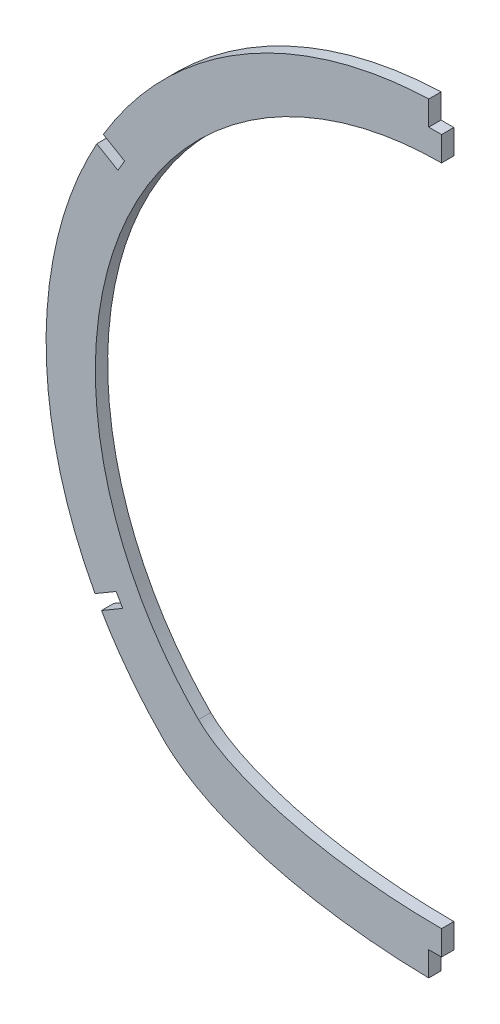
from build123d import *

# Parameters (mm, degrees)
BOSS_EXTRUDE1_DEPTH = 3.175
SKETCH3_W           = 129.389558459
SKETCH3_H           = 294.720660933
CUT_EXTRUDE1_DEPTH  = 146.946732918
SKETCH4_W           = 3.302
SKETCH4_H           = 12.7
CUT_EXTRUDE2_DEPTH  = 146.946732911


with BuildPart() as part:
    # Sketch2 → Boss-Extrude1 (new body)
    with BuildSketch(Plane.XY):
        with BuildLine():
            add(Edge.make_bspline(
                [(-71.677392112, -72.91043434), (-72.109242456, -72.4766599), (-72.972872043, -71.593614958), (-74.469591152, -70.002616718), (-75.837182996, -68.488043391), (-77.186084408, -66.931897067), (-78.515677479, -65.334729876), (-79.824432739, -63.69624614), (-81.54760822, -61.446428575), (-83.64161213, -58.529673548), (-85.629566809, -55.501403393), (-87.162218254, -52.997335562), (-88.285911427, -51.070131488), (-90.114728738, -47.772436811), (-92.549922179, -42.891387424), (-95.3516338, -36.175158441), (-97.806777615, -28.854790192), (-99.416568113, -22.492651102), (-100.484378106, -16.973479224), (-101.217383692, -12.115821661), (-101.805900705, -6.108471449), (-102.055561509, 1.055644647), (-101.63758347, 11.916616183), (-99.581715265, 24.703392789), (-94.947787628, 39.477591596), (-88.656512854, 52.708120751), (-80.043367163, 65.554146484), (-69.871244821, 76.755385293), (-58.636991603, 85.914826096), (-47.202028885, 92.898966836), (-35.790499648, 98.052224226), (-24.000842482, 101.716725174), (-12.029496563, 103.894248368), (-3.656941748, 104.395312689), (0.99110515, 104.372307848), (2.644688984, 104.347784008), (5.295920706, 104.255895368), (8.944129249, 104.002381094), (12.923536456, 103.566176285), (16.897932891, 102.969160213), (20.860675893, 102.210568115), (24.80503533, 101.28991654), (28.724197829, 100.207008268), (32.611281662, 98.961940132), (36.459348765, 97.555109249), (39.942943882, 96.118550993), (42.44327487, 94.981609399), (43.99462248, 94.237634049), (44.922549304, 93.78091779), (45.846607961, 93.314294304), (46.766722746, 92.837849145), (47.682656642, 92.351383169), (48.561810847, 91.873519084), (49.188310006, 91.524412896), (49.500915025, 91.348034768)],
                knots=[0, 0, 0, 0, 0.006795371, 0.013653749, 0.020575359, 0.027560428, 0.034609183, 0.041721853, 0.048898669, 0.063445664, 0.078252032, 0.085753069, 0.093319659, 0.100952039, 0.124124286, 0.148784986, 0.174947707, 0.20262677, 0.215493637, 0.232144402, 0.252599943, 0.276885796, 0.305032091, 0.363115877, 0.408011314, 0.462235121, 0.511576331, 0.564908162, 0.615597651, 0.658548959, 0.700915758, 0.742691235, 0.783870362, 0.824449909, 0.827808956, 0.831171349, 0.841278604, 0.854801757, 0.868378359, 0.882008332, 0.895691582, 0.909427999, 0.923217451, 0.937059793, 0.95095486, 0.964902468, 0.975397534, 0.978902417, 0.982410558, 0.985921952, 0.989436598, 0.99295449, 0.996475625, 1, 1, 1, 1], degree=3))
            add(Edge.make_bspline(
                [(49.500915025, 91.348034768), (49.872005924, 91.138482333), (50.241810712, 90.926750039), (50.610303013, 90.712853821)],
                knots=[0, 0, 0, 0, 1, 1, 1, 1], degree=3))
            add(Edge.make_bspline(
                [(50.610303013, 90.712853821), (51.128442093, 90.411846037), (52.167202685, 89.796039228), (53.932536969, 88.703576387), (55.579762788, 87.638711627), (57.218137155, 86.533145805), (58.847026669, 85.387425363), (60.465187486, 84.201108463), (62.61485058, 82.559008476), (65.268683437, 80.403244909), (68.38020159, 77.661045558), (71.420405526, 74.753669295), (74.379227375, 71.68115848), (77.246352549, 68.444125522), (79.542797672, 65.619898893), (81.324264236, 63.280297585), (82.635173495, 61.479754257), (83.915139631, 59.639466174), (85.682600666, 56.976700672), (87.896856718, 53.369477174), (90.462597049, 48.676901727), (92.889220315, 43.626105667), (95.132677705, 38.215723181), (97.146538959, 32.44823322), (98.88212407, 26.330630408), (100.289240179, 19.875099059), (101.25863273, 13.473856941), (101.817336128, 7.24671143), (102.015185645, 1.305015561), (101.87858065, -4.624237286), (101.39263307, -10.734726225), (100.537146292, -16.867570025), (99.329398352, -22.86381348), (97.893600846, -28.372193875), (96.656960211, -32.269847721), (95.785564151, -34.744415114), (95.0459628, -36.764317914), (93.953188789, -39.535816997), (92.43580554, -43.007047711), (90.821696456, -46.36490671), (89.118620831, -49.608230444), (87.334164726, -52.736260206), (85.475724639, -55.748623833), (83.55049497, -58.64531039), (81.56545684, -61.42664709), (79.307705413, -64.380683017), (77.436977348, -66.647222523), (76.007346494, -68.288860963), (75.29509586, -69.089727056), (74.579038656, -69.87823774), (73.859443089, -70.654502436), (73.136338858, -71.418398838), (72.317504882, -72.264736672), (71.891235125, -72.69667798), (71.678426975, -72.91043429)],
                knots=[0, 0, 0, 0, 0.010157109, 0.020393378, 0.030708694, 0.04110294, 0.051575992, 0.062127721, 0.072757993, 0.094253595, 0.116061609, 0.138180754, 0.160609666, 0.183346893, 0.206390897, 0.218027437, 0.229740057, 0.241528542, 0.253392669, 0.280162256, 0.30828042, 0.337739229, 0.368530108, 0.400643849, 0.434070605, 0.468799897, 0.504820602, 0.536144777, 0.567394405, 0.598569553, 0.629670285, 0.664058743, 0.696204476, 0.726123241, 0.753829745, 0.760691378, 0.767515904, 0.787767528, 0.807687634, 0.827278023, 0.846540474, 0.865476741, 0.88408856, 0.902377642, 0.920345676, 0.937994331, 0.961031903, 0.966703489, 0.972340071, 0.97794171, 0.983508463, 0.989040391, 0.99453755, 1, 1, 1, 1], degree=3))
            add(Edge.make_bspline(
                [(71.678426975, -72.91043429), (46.359928794, -98.341734638), (-46.358893881, -98.341734638), (-71.677392112, -72.91043434)],
                knots=[0, 0, 0, 0, 1, 1, 1, 1], degree=3, weights=[1, 1, 1, 1]))
        make_face()
        with BuildLine():
            add(Edge.make_bspline(
                [(-62.677197057, -63.950161522), (-62.895509204, -63.730876692), (-63.321725733, -63.298342375), (-64.002059554, -62.592101669), (-64.753829554, -61.794622516), (-65.703931611, -60.764569773), (-66.804574903, -59.527416198), (-68.556788175, -57.468052236), (-70.648178443, -54.835505477), (-73.811350461, -50.469012961), (-77.394544541, -44.756057433), (-82.302878117, -35.13540616), (-86.810757895, -22.360038108), (-90.354277409, -0.967371821), (-87.649941962, 26.350088977), (-73.333390238, 55.972118358), (-49.623996274, 78.708841275), (-24.487235723, 89.383519301), (-3.090994932, 92.115890306), (13.038963103, 91.197514401), (26.120286031, 87.996586306), (34.879374941, 84.524845656), (39.102105625, 82.510352052), (41.214271269, 81.410816796), (42.347028641, 80.797644792), (42.959233617, 80.456937494), (43.258169219, 80.288282027)],
                knots=[0, 0, 0, 0, 0.003906217, 0.007812434, 0.01171865, 0.015624867, 0.023437301, 0.031249734, 0.046874602, 0.062499469, 0.093749203, 0.124998938, 0.187498407, 0.249997875, 0.374996813, 0.499995751, 0.624994688, 0.749993626, 0.812493095, 0.874992564, 0.937492033, 0.968741767, 0.984366634, 0.992179068, 0.996085285, 0.999991501, 0.999991501, 0.999991501, 0.999991501], degree=3))
            add(Edge.make_bspline(
                [(43.258169219, 80.288282027), (43.339663738, 80.24226006), (43.502520945, 80.149972739), (43.746371392, 80.01083423), (43.989796594, 79.870982545), (44.151786326, 79.777278604), (44.232713854, 79.73030574)],
                knots=[0.002022438, 0.002022438, 0.002022438, 0.002022438, 0.251013535, 0.500004632, 0.748995729, 0.997986827, 0.997986827, 0.997986827, 0.997986827], degree=3))
            add(Edge.make_bspline(
                [(44.232713854, 79.73030574), (44.58444416, 79.525959484), (45.259622085, 79.127643656), (46.415361761, 78.422292298), (47.573803007, 77.692810893), (49.007921659, 76.758403592), (50.804832808, 75.530634538), (53.607223777, 73.493209173), (57.003409969, 70.790302329), (64.764138566, 63.842060668), (74.853642347, 51.769295456), (84.311822541, 33.000711524), (89.302574517, 12.581832114), (89.594071681, -8.463887057), (85.167338267, -29.022546245), (78.471156755, -43.288686452), (72.737789819, -52.004533398), (70.145497848, -55.492337454), (67.954788222, -58.18874646), (66.537169113, -59.834423786), (65.376799992, -61.124092609), (64.636118066, -61.923784826), (64.04885936, -62.544039678), (63.540759488, -63.072130947), (63.065749199, -63.559376825), (62.8132246, -63.814567336), (62.678231924, -63.950161468)],
                knots=[1.4601e-05, 1.4601e-05, 1.4601e-05, 1.4601e-05, 0.007826987, 0.015639373, 0.023451759, 0.031264145, 0.046888916, 0.062513688, 0.093763232, 0.125012776, 0.250010951, 0.375009125, 0.5000073, 0.625005475, 0.75000365, 0.875001825, 0.906251369, 0.937500913, 0.953125684, 0.968750456, 0.976562842, 0.984375228, 0.988281421, 0.992187614, 0.996093807, 1, 1, 1, 1], degree=3))
            add(Edge.make_bspline(
                [(62.678231924, -63.950161468), (62.442110433, -64.187331736), (61.973465348, -64.632177633), (60.848308103, -65.594894105), (59.178943877, -66.825880953), (56.737455869, -68.325151322), (52.942333804, -70.28884928), (47.260951473, -72.599488515), (39.221466424, -74.977986937), (30.229046438, -76.880115217), (17.304785319, -78.721740765), (0.000517457, -79.658688067), (-17.303750406, -78.721740765), (-30.228011525, -76.880115217), (-39.22043151, -74.977986937), (-47.25991656, -72.599488515), (-52.941298891, -70.28884928), (-56.736420955, -68.325151322), (-59.177908963, -66.825880953), (-60.84727319, -65.594894105), (-61.972430435, -64.632177633), (-62.441075519, -64.187331736), (-62.677197057, -63.950161522)],
                knots=[0, 0, 0, 0, 0.015625, 0.03125, 0.0625, 0.09375, 0.125, 0.1875, 0.25, 0.3125, 0.375, 0.5, 0.625, 0.6875, 0.75, 0.8125, 0.875, 0.90625, 0.9375, 0.96875, 0.984375, 1, 1, 1, 1], degree=3))
        make_face(mode=Mode.SUBTRACT)
    extrude(amount=-BOSS_EXTRUDE1_DEPTH)

    # Sketch3 → Cut-Extrude1 (cut, through all)
    with BuildSketch(Plane(origin=(0, 0, 0), x_dir=(0, 0, -1), z_dir=(1, 0, 0))):
        with Locations((3.684090068, 10.698040846)):
            Rectangle(SKETCH3_W, SKETCH3_H)
    extrude(amount=CUT_EXTRUDE1_DEPTH, mode=Mode.SUBTRACT)

    # Sketch4 → Cut-Extrude2 (cut, through all)
    with BuildSketch(Plane(origin=(0, 0, -3.175), x_dir=(-1, 0, 0), z_dir=(0, 0, -1))):
        with Locations((1.651, 104.37520294)):
            Rectangle(SKETCH4_W, SKETCH4_H)
        Polygon((81.722062158, 51.245774998), (83.431923254, 48.332253027), (94.385013368, 54.760302263), (92.675152271, 57.673824233), align=None)
        Polygon((82.193637427, -48.868559709), (83.903498529, -45.955037742), (94.85658863, -52.383086998), (93.146727528, -55.296608965), align=None)
        with Locations((1.651, -91.983909146)):
            Rectangle(SKETCH4_W, SKETCH4_H)
    extrude(amount=-CUT_EXTRUDE2_DEPTH, mode=Mode.SUBTRACT)


solid = part.part
